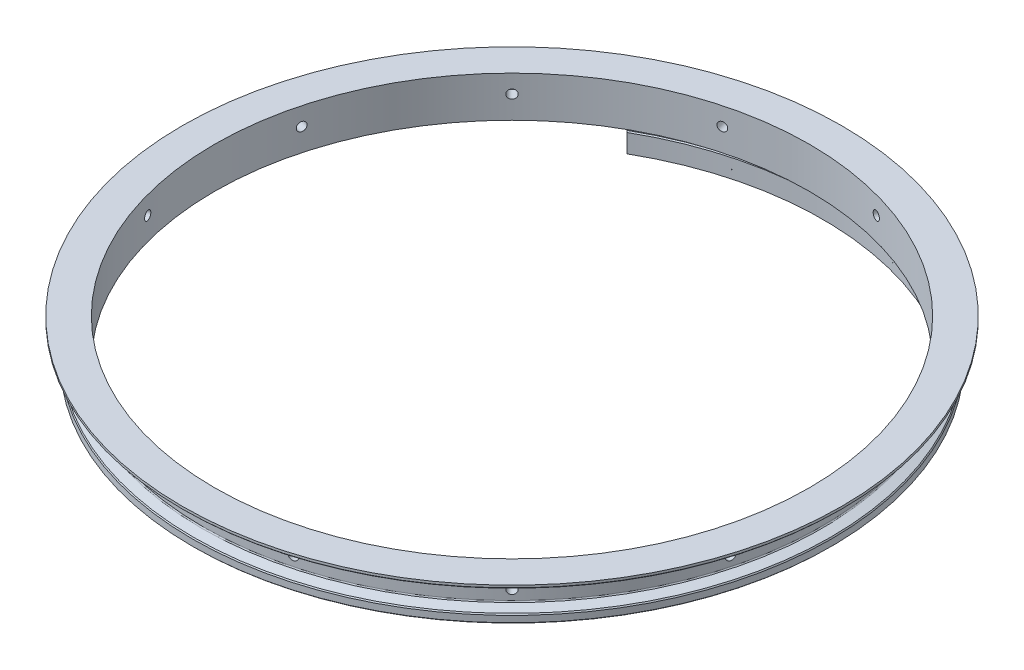
from build123d import *
from OCP.BRepFilletAPI import BRepFilletAPI_MakeChamfer

# Parameters (mm, degrees)
SKETCH3_W          = 84.455
SKETCH3_H          = 0.381
CUT_EXTRUDE1_DEPTH = 122.077195012
CIRPATTERN2_START  = -9.401919884
CIRPATTERN2_DEPTH  = 18.803839768
FILLET1_R          = 0.508
CHAMFER6_SIZE      = 0.254
CHAMFER6_SIZE2     = 0.197576926
CHAMFER5_SIZE      = 0.254
CHAMFER5_SIZE2     = 0.253429
CHAMFER2_SIZE      = 1.5
CHAMFER2_SIZE2     = 3.8
FILLET2_R          = 0.3175
CHAMFER4_SIZE      = 0.254
CHAMFER7_SIZE      = 0.254
CHAMFER7_SIZE2     = 0.197576926
CIRPATTERN5_COUNT  = 6


# Read off the part's stored shape, not the designer's step: moduleRing, CirPattern2, Mirror10
with BuildPart() as part:
    # moduleRing outline → moduleRing (revolve)
    with BuildSketch(Plane.XY):
        Polygon((76.2, 10.457412986), (76.2, 0), (81.8275, 0), (81.8275, 2.145588094), (79.2, 3.101919884), (79.2, 9.601919884), (84.455, 9.601919884), (84.455, 10.457412986), align=None)
    revolve(axis=Axis((0, 0, 0), (0, 1, 0)))

    # Fillet2
    fillet2_edges = [part.edges().sort_by_distance(p)[0] for p in [
        (-79.2, 9.601919884, 0),
        (-79.2, 3.101919884, 0),
    ]]
    fillet(fillet2_edges, radius=FILLET2_R)

    # Chamfer4
    chamfer4_edges = [part.edges().sort_by_distance(p)[0] for p in [
        (-84.455, 9.601919884, 0),
        (-81.8275, 0, 0),
    ]]
    chamfer(chamfer4_edges, length=CHAMFER4_SIZE)

    # Chamfer7
    chamfer7_edges = [part.edges().sort_by_distance(p)[0] for p in [
        (-81.8275, 2.145588094, 0),
    ]]
    chamfer7_side = [part.faces().sort_by_distance(p)[0] for p in [
        (-81.8275, 1.199794047, 0),
    ]]
    chamfer(chamfer7_edges, length=CHAMFER7_SIZE, length2=CHAMFER7_SIZE2, reference=chamfer7_side[0])

    # Sketch19 → #4-40 Tapped Hole1 (revolve, cut)
    with BuildSketch(Plane(origin=(19.39331105, 5.801919884, -72.376822164), x_dir=(0.9659258262890699, 0, 0.25881904510251463), z_dir=(0, 1, 0))):
        Polygon((0, 0), (0, 147.100152758), (1.1303, 146.421), (1.1303, 0), align=None)
    f_4_40_tapped_hole1 = revolve(axis=Axis((17.749810113, 5.801919884, -66.243193167), (0.2588190451025147, 0, -0.9659258262890699)), mode=Mode.SUBTRACT)

    # Mirror8: #4-40 Tapped Hole1 across plane
    add(f_4_40_tapped_hole1.mirror(Plane(origin=(0, 0, 0), x_dir=(0, 0, 1), z_dir=(1, 0, 0))), mode=Mode.SUBTRACT)

    # CirPattern5: #4-40 Tapped Hole1 ×6 about axis
    cirpattern5_axis = Axis((0, 47.75171456, 0), (0, 1, 0))
    for i in range(1, CIRPATTERN5_COUNT):
        add(f_4_40_tapped_hole1.rotate(cirpattern5_axis, i * 360 / CIRPATTERN5_COUNT), mode=Mode.SUBTRACT)

    # CirPattern5 copy 1 sketch → CirPattern5 copy 1 (revolve, cut)
    with BuildSketch(Plane(origin=(-72.376822164, 5.801919884, -19.39331105), x_dir=(-0.25881904510252696, 0, 0.9659258262890666), z_dir=(0, 1, 0))):
        Polygon((0, 0), (0, -147.100152758), (1.1303, -146.421), (1.1303, 0), align=None)
    revolve(axis=Axis((-66.243193167, 5.801919884, -17.749810113), (0.9659258262890666, 0, 0.25881904510252696)), mode=Mode.SUBTRACT)

    # CirPattern5 copy 2 sketch → CirPattern5 copy 2 (revolve, cut)
    with BuildSketch(Plane(origin=(-52.983511114, 5.801919884, 52.983511114), x_dir=(0.7071067811865428, 0, 0.7071067811865521), z_dir=(0, 1, 0))):
        Polygon((0, 0), (0, -147.100152758), (1.1303, -146.421), (1.1303, 0), align=None)
    revolve(axis=Axis((-48.493383054, 5.801919884, 48.493383054), (0.7071067811865521, 0, -0.7071067811865428)), mode=Mode.SUBTRACT)

    # CirPattern5 copy 3 sketch → CirPattern5 copy 3 (revolve, cut)
    with BuildSketch(Plane(origin=(19.39331105, 5.801919884, 72.376822164), x_dir=(0.9659258262890699, 0, -0.2588190451025145), z_dir=(0, 1, 0))):
        Polygon((0, 0), (0, -147.100152758), (1.1303, -146.421), (1.1303, 0), align=None)
    revolve(axis=Axis((17.749810113, 5.801919884, 66.243193167), (-0.2588190451025146, 0, -0.9659258262890699)), mode=Mode.SUBTRACT)

    # CirPattern5 copy 4 sketch → CirPattern5 copy 4 (revolve, cut)
    with BuildSketch(Plane(origin=(72.376822164, 5.801919884, 19.39331105), x_dir=(0.2588190451025274, 0, -0.9659258262890664), z_dir=(0, 1, 0))):
        Polygon((0, 0), (0, -147.100152758), (1.1303, -146.421), (1.1303, 0), align=None)
    revolve(axis=Axis((66.243193167, 5.801919884, 17.749810113), (-0.9659258262890665, 0, -0.2588190451025273)), mode=Mode.SUBTRACT)

    # CirPattern5 copy 5 sketch → CirPattern5 copy 5 (revolve, cut)
    with BuildSketch(Plane(origin=(52.983511114, 5.801919884, -52.983511114), x_dir=(-0.7071067811865431, 0, -0.7071067811865519), z_dir=(0, 1, 0))):
        Polygon((0, 0), (0, -147.100152758), (1.1303, -146.421), (1.1303, 0), align=None)
    revolve(axis=Axis((48.493383054, 5.801919884, -48.493383054), (-0.7071067811865519, 0, 0.7071067811865431)), mode=Mode.SUBTRACT)


with BuildPart() as body_2:
    # Sketch1<5> → clampArc (revolve)
    with BuildSketch(Plane.XY, mode=Mode.PRIVATE) as clamparc_sk:
        Polygon((79.6, 9.401919884), (79.6, 2.956331791), (82.2275, 2), (82.2275, -2), (79.6, -2.956331791), (79.6, -9.401919884), (84.455, -9.401919884), (84.455, 9.401919884), align=None)
    revolve(clamparc_sk.sketch.rotate(Axis((0, 47.75171456, 0), (0, -1, 0)), 90), axis=Axis((0, 47.75171456, 0), (0, -1, 0)))

    # Sketch3 → Cut-Extrude1 (cut, symmetric)
    with BuildSketch(Plane.XZ.offset(9.401919884)):
        with Locations((42.2275, 0)):
            Rectangle(SKETCH3_W, SKETCH3_H)
    extrude(amount=CUT_EXTRUDE1_DEPTH, both=True, mode=Mode.SUBTRACT)

    # CirPattern2 outline → CirPattern2 (cut)
    with BuildSketch(Plane(origin=(0, 0, 0), x_dir=(1, 0, 0), z_dir=(0, 1, 0)).offset(CIRPATTERN2_START)):
        with BuildLine():
            ThreePointArc((84.45478515, 0.1905), (73.044739411, 42.392370414), (42.062414736, 73.235239411))
            Line((42.062414736, 73.235239411), (39.634908184, 69.030674727))
            ThreePointArc((39.634908184, 69.030674727), (68.840174727, 39.964863862), (79.599772046, 0.1905))
            Line((79.599772046, 0.1905), (84.45478515, 0.1905))
        make_face()
        with BuildLine():
            ThreePointArc((-42.062414736, 73.235239411), (-42.392370414, -73.044739411), (84.45478515, -0.1905))
            Line((84.45478515, -0.1905), (79.599772046, -0.1905))
            ThreePointArc((79.599772046, -0.1905), (-39.964863862, -68.840174727), (-39.634908183, 69.030674727))
            Line((-39.634908183, 69.030674727), (-42.062414736, 73.235239411))
        make_face()
    extrude(amount=CIRPATTERN2_DEPTH, mode=Mode.SUBTRACT)

    # Fillet1
    fillet1_edges = [body_2.edges().sort_by_distance(p)[0] for p in [
        (0, 2, -82.2275),
        (0, -2, -82.2275),
    ]]
    fillet(fillet1_edges, radius=FILLET1_R)

    # Chamfer6: one chamfer whose edges measure the first distance from different faces: ONE call of the kernel's chamfer builder (chamfer() names one face for all edges)
    chamfer6_edges_1 = [body_2.edges().sort_by_distance(p)[0] for p in [
        (0, -2.956331791, -79.6),
    ]]
    chamfer6_side_1 = [body_2.faces().sort_by_distance(p)[0] for p in [
        (0, -2.538995106, -80.746623116),
    ]]
    chamfer6_edges_2 = [body_2.edges().sort_by_distance(p)[0] for p in [
        (0, 2.956331791, -79.6),
    ]]
    chamfer6_side_2 = [body_2.faces().sort_by_distance(p)[0] for p in [
        (0, 6.179125837, -79.6),
    ]]
    chamfer6 = BRepFilletAPI_MakeChamfer(body_2.part.solid().wrapped)
    for e in chamfer6_edges_1:
        chamfer6.Add(CHAMFER6_SIZE, CHAMFER6_SIZE2, e.wrapped, chamfer6_side_1[0].wrapped)  # the first distance lies on this face
    for e in chamfer6_edges_2:
        chamfer6.Add(CHAMFER6_SIZE, CHAMFER6_SIZE2, e.wrapped, chamfer6_side_2[0].wrapped)  # the first distance lies on this face
    add(Compound.cast(chamfer6.Shape()), mode=Mode.REPLACE)

    # Sketch17 → Ø0.15 (0.15) Diameter Hole1 (revolve, cut)
    with BuildSketch(Plane(origin=(21.858562454, -5.801919884, -81.577265659), x_dir=(-0.9659258262890681, 0, -0.2588190451025214), z_dir=(0, 1, 0))):
        Polygon((0, 0), (0, 5.245064546), (0.075, 5.2), (0.075, 0), align=None)
    f_0_15_0_15_diameter_hole1 = revolve(axis=Axis((23.502063391, -5.801919884, -87.710894656), (-0.2588190451025214, 0, 0.9659258262890682)), mode=Mode.SUBTRACT)

    # Mirror5: Ø0.15 (0.15) Diameter Hole1 across plane
    add(f_0_15_0_15_diameter_hole1.mirror(Plane.ZX), mode=Mode.SUBTRACT)

    # Mirror6: Ø0.15 (0.15) Diameter Hole1 across plane
    add(f_0_15_0_15_diameter_hole1.mirror(Plane(origin=(0, 0, 0), x_dir=(0, 0, 1), z_dir=(1, 0, 0))), mode=Mode.SUBTRACT)

    # Mirror6 copy 1 sketch → Mirror6 copy 1 (revolve, cut)
    with BuildSketch(Plane(origin=(-21.858562454, 5.801919884, -81.577265659), x_dir=(0.9659258262890681, 0, -0.2588190451025214), z_dir=(0, -1, 0))):
        Polygon((0, 0), (0, 5.245064546), (0.075, 5.2), (0.075, 0), align=None)
    revolve(axis=Axis((-23.502063391, 5.801919884, -87.710894656), (0.2588190451025214, 0, 0.9659258262890682)), mode=Mode.SUBTRACT)

    # Chamfer5: one chamfer whose edges measure the first distance from different faces: ONE call of the kernel's chamfer builder (chamfer() names one face for all edges)
    chamfer5_edges_1 = [body_2.edges().sort_by_distance(p)[0] for p in [
        (0, 9.401919884, -84.455),
        (0, -9.401919884, -84.455),
    ]]
    chamfer5_edges_2 = [body_2.edges().sort_by_distance(p)[0] for p in [
        (-42.062414736, 0, -73.235239411),
    ]]
    chamfer5_side_2 = [body_2.faces().sort_by_distance(p)[0] for p in [
        (-40.949094764, -7.604e-06, -71.306912655),
    ]]
    chamfer5_edges_3 = [body_2.edges().sort_by_distance(p)[0] for p in [
        (42.062414736, 0, -73.235239411),
    ]]
    chamfer5_side_3 = [body_2.faces().sort_by_distance(p)[0] for p in [
        (40.949094765, -7.604e-06, -71.306912655),
    ]]
    chamfer5 = BRepFilletAPI_MakeChamfer(body_2.part.solid().wrapped)
    for e in chamfer5_edges_1:
        chamfer5.Add(CHAMFER5_SIZE, e.wrapped)
    for e in chamfer5_edges_2:
        chamfer5.Add(CHAMFER5_SIZE, CHAMFER5_SIZE2, e.wrapped, chamfer5_side_2[0].wrapped)  # the first distance lies on this face
    for e in chamfer5_edges_3:
        chamfer5.Add(CHAMFER5_SIZE, CHAMFER5_SIZE2, e.wrapped, chamfer5_side_3[0].wrapped)  # the first distance lies on this face
    add(Compound.cast(chamfer5.Shape()), mode=Mode.REPLACE)

    # Chamfer2
    chamfer2_edges = [body_2.edges().sort_by_distance(p)[0] for p in [
        (0, -9.401919884, -79.6),
    ]]
    chamfer2_side = [body_2.faces().sort_by_distance(p)[0] for p in [
        (0, -6.277914299, -79.6),
    ]]
    chamfer(chamfer2_edges, length=CHAMFER2_SIZE, length2=CHAMFER2_SIZE2, reference=chamfer2_side[0])

    # Mirror10 outline → Mirror10 (revolve, cut)
    with BuildSketch(Plane.XY):
        Polygon((79.6, 9.401919884), (79.6, 7.901919884), (83.4, 9.401919884), align=None)
    revolve(axis=Axis((0, 0, 0), (0, 1, 0)), mode=Mode.SUBTRACT)


solid = Compound([part.part, body_2.part])
